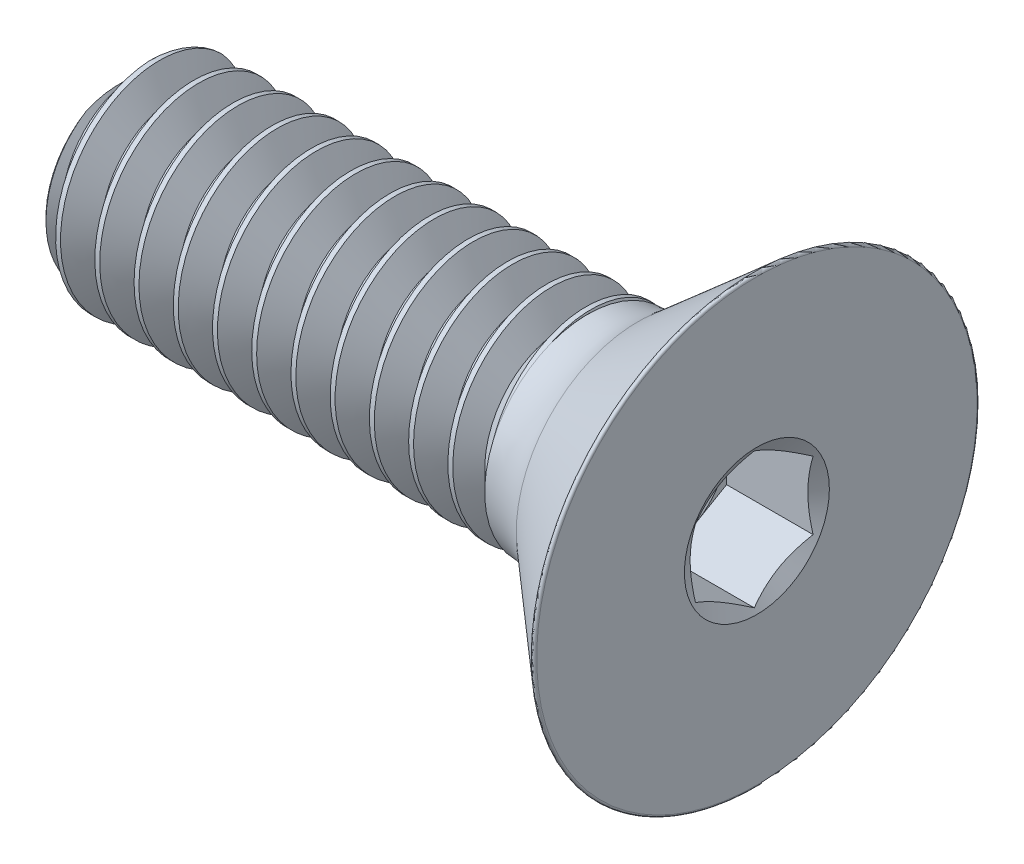
from build123d import *

# Parameters (mm, degrees)
CUT_EXTRUDE1_DEPTH = 1.8034
FILLET1_R          = 0.045593
DELETEFACE1_START  = 3
DELETEFACE1_DEPTH  = 1.5466
CUT_SWEEP1_PITCH   = 0.79375
CUT_SWEEP1_TO      = 9.27446


with BuildPart() as part:
    # Sketch3 → Revolve1 (revolve)
    with BuildSketch(Plane.XY, mode=Mode.PRIVATE) as revolve1_sk:
        with BuildLine():
            Line((-5.953125, 2.0828), (-6.35, 1.685925))
            Line((-6.35, 1.685925), (-6.35, 0))
            Line((-6.35, 0), (6.35, 0))
            Line((6.35, 0), (6.35, 4.555746912))
            Line((6.35, 4.555746912), (3.943490363, 2.4638))
            ThreePointArc((3.943490363, 2.4638), (3.46842298, 2.181164608), (2.924459574, 2.0828))
            Line((2.924459574, 2.0828), (-5.953125, 2.0828))
        make_face()
    revolve(revolve1_sk.sketch.rotate(Axis((6.35, 0, 0), (-1, 0, 0)), 90), axis=Axis((6.35, 0, 0), (-1, 0, 0)))

    # Sketch4 → Cut-Extrude1 (cut)
    with BuildSketch(Plane(origin=(6.35, 0, 0), x_dir=(0, 0, -1), z_dir=(1, 0, 0))):
        Polygon((0, 1.374815329), (-1.190625, 0.687407664), (-1.190625, -0.687407664), (0, -1.374815329), (1.190625, -0.687407664), (1.190625, 0.687407664), align=None)
    extrude(amount=-CUT_EXTRUDE1_DEPTH, mode=Mode.SUBTRACT)

    # Cut-Extrude2 cone 1 section (through the dimple's axis) → Cut-Extrude2 (revolve, cut)
    with BuildSketch(Plane(origin=(6.35, 0, 0), x_dir=(0, 0, -1), z_dir=(0, 1, 0))):
        Polygon((0, 0), (1.466910493, 0), (0, 0.846921168), align=None)
    revolve(axis=Axis((6.35, 0, 0), (-1, 0, 0)), mode=Mode.SUBTRACT)

    # Cut-Extrude3 cone 1 section (through the dimple's axis) → Cut-Extrude3 (revolve, cut)
    with BuildSketch(Plane(origin=(4.5466, 0, 0), x_dir=(0, 0, -1), z_dir=(0, 1, 0))):
        Polygon((0, 0), (1.190625, 0), (0, 0.687407664), align=None)
    revolve(axis=Axis((4.5466, 0, 0), (-1, 0, 0)), mode=Mode.SUBTRACT)

    # Fillet1
    fillet1_edges = [part.edges().sort_by_distance(p)[0] for p in [
        (6.35, 0, 4.555746912),
    ]]
    fillet(fillet1_edges, radius=FILLET1_R)

    # DeleteFace1: read off the stored shape, not the designer's step
    # DeleteFace1 outline → DeleteFace1 (add)
    with BuildSketch(Plane.YZ.offset(DELETEFACE1_START)):
        Polygon((-0.687407664, -1.190625), (0.687407664, -1.190625), (1.374815329, 0), (0.687407664, 1.190625), (-0.687407664, 1.190625), (-1.374815329, 0), align=None)
    extrude(amount=DELETEFACE1_DEPTH)


with BuildPart() as body_2:
    # Split1: the piece on the far side of the plane
    add(part.part)
    split(bisect_by=Plane(origin=(2.924459574, 0, 0), x_dir=(0, 0, 1), z_dir=(1, 0, 0)), keep=Keep.BOTTOM)

    # Cut-Sweep1: arcs per turn and ends read off the stored shape
    # Cut-Sweep1: the profile of Sketch7 screwed along a right-hand helix through 16 turns, 8 arcs to a turn; built about Z, then put on its axis
    cut_sweep1_z = Axis((0, 0, 0), (0, 0, 1))
    cut_sweep1_corners = [(1.567244252, 0, -0.396875), (2.125762979, 0, -0.719335937), (2.125762979, 0, 0.024804687), (1.567244252, 0, -0.29765625)]
    with BuildLine(mode=Mode.PRIVATE) as cut_sweep1_profile:
        Line(cut_sweep1_corners[0], cut_sweep1_corners[1])
        Line(cut_sweep1_corners[1], cut_sweep1_corners[2])
        Line(cut_sweep1_corners[2], cut_sweep1_corners[3])
        Line(cut_sweep1_corners[3], cut_sweep1_corners[0])
    cut_sweep1_cap = Face(cut_sweep1_profile.wire())
    cut_sweep1_turn_angles = [0, 22.5, 45, 67.5, 90, 112.5, 135, 157.5, 180, 202.5, 225, 247.5, 270, 292.5, 315, 337.5, 360]
    cut_sweep1_turn_weights = [1, 0.9238795325112867, 1, 0.9238795325112867, 1, 0.9238795325112867, 1, 0.9238795325112867, 1, 0.9238795325112867, 1, 0.9238795325112867, 1, 0.9238795325112867, 1, 0.9238795325112867, 1]
    cut_sweep1_turn_rails = [Edge.make_bspline([Vector(p[0], p[1], 0).rotate(cut_sweep1_z, cut_sweep1_turn_angles[k]) / cut_sweep1_turn_weights[k] + Vector(0, 0, p[2] + CUT_SWEEP1_PITCH * cut_sweep1_turn_angles[k] / 360) for k in range(17)], [0, 0, 0, 1, 1, 2, 2, 3, 3, 4, 4, 5, 5, 6, 6, 7, 7, 8, 8, 8], 2, cut_sweep1_turn_weights) for p in cut_sweep1_corners]
    cut_sweep1_turn_sides = [Face.make_surface_from_curves(cut_sweep1_turn_rails[p[0]], cut_sweep1_turn_rails[p[1]]) for p in [(0, 1), (1, 2), (2, 3), (3, 0)]]
    cut_sweep1 = Plane(origin=(-6.35, 0, 0), x_dir=(0, -1, 0), z_dir=(1, 0, 0)) * split(Solid(Shell([*[p.moved(Location((0, 0, CUT_SWEEP1_PITCH * i))) for i in range(16) for p in cut_sweep1_turn_sides], cut_sweep1_cap, cut_sweep1_cap.rotate(cut_sweep1_z, 5760).moved(Location((0, 0, CUT_SWEEP1_PITCH * 5760 / 360)))])), bisect_by=Plane.XY.offset(CUT_SWEEP1_TO), keep=Keep.BOTTOM, mode=Mode.PRIVATE)
    add(cut_sweep1, mode=Mode.SUBTRACT)


with BuildPart() as part_1:
    add(part.part)

    # Split1
    split(bisect_by=Plane(origin=(2.924459574, 0, 0), x_dir=(0, 0, 1), z_dir=(1, 0, 0)), keep=Keep.TOP)

    add(body_2.part)  # Revolve2 merges body 2
    # Sketch9 → Revolve2 (revolve)
    with BuildSketch(Plane.XY, mode=Mode.PRIVATE) as revolve2_sk:
        with BuildLine():
            Line((2.924459574, 2.0828), (2.924459574, 0))
            Line((2.924459574, 0), (3.943490363, 0))
            Line((3.943490363, 0), (3.943490363, 2.4638))
            ThreePointArc((3.943490363, 2.4638), (3.46842298, 2.181164608), (2.924459574, 2.0828))
        make_face()
    revolve(revolve2_sk.sketch.rotate(Axis((2.924459574, 0, 0), (1, 0, 0)), 66.397842696), axis=Axis((2.924459574, 0, 0), (1, 0, 0)))

    # Cut-Extrude4 cone 1 section (through the dimple's axis) → Cut-Extrude4 (revolve, cut)
    with BuildSketch(Plane(origin=(4.5466, 0, 0), x_dir=(0, 0, -1), z_dir=(0, 1, 0))):
        Polygon((0, 0), (1.190625, 0), (0, 0.687407664), align=None)
    revolve(axis=Axis((4.5466, 0, 0), (-1, 0, 0)), mode=Mode.SUBTRACT)

    # Boss-Extrude1: read off the stored shape, not the designer's step
    # Boss-Extrude1 outline → Boss-Extrude1 (revolve)
    with BuildSketch(Plane.YX):
        Polygon((1.567239911, 2.924459574), (1.567239911, 2.408899485), (2.0828, 2.924459574), align=None)
    revolve(axis=Axis((0, 0, 0), (1, 0, 0)))


solid = part_1.part
